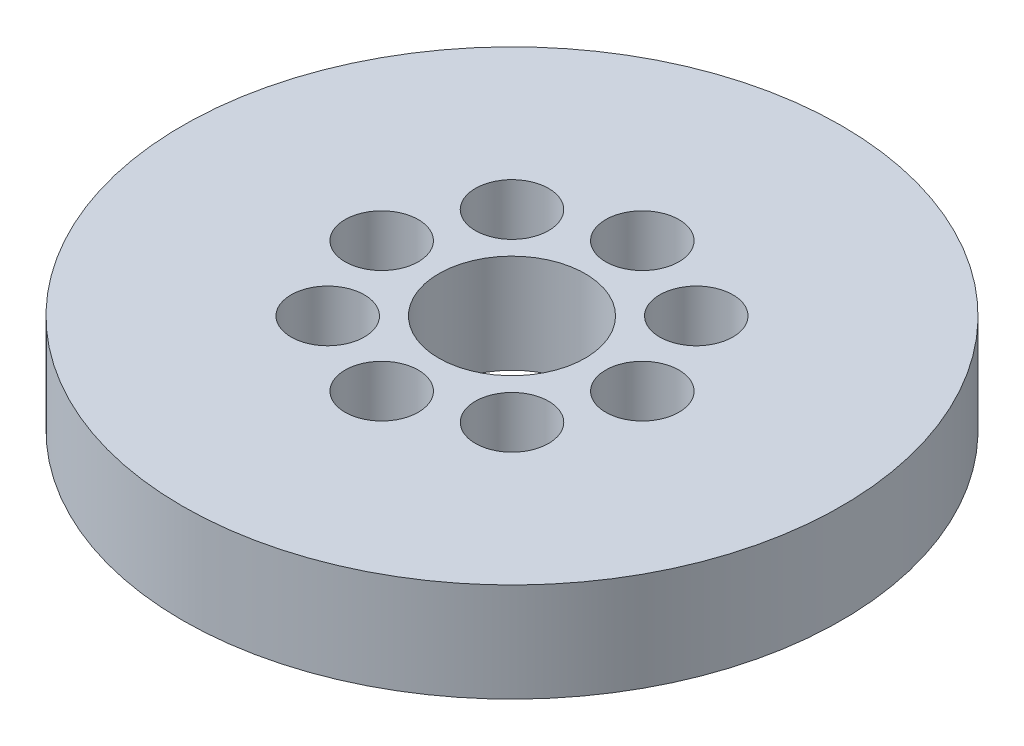
from build123d import *

# Parameters (mm, degrees)
SKETCH1_R           = 90
BOSS_EXTRUDE1_DEPTH = 27
SKETCH2_R           = 20
CUT_EXTRUDE1_DEPTH  = 131.111490653
SKETCH3_R           = 10
CUT_EXTRUDE2_DEPTH  = 20.262050617
CIRPATTERN1_COUNT   = 8


with BuildPart() as part:
    # Sketch1 → Boss-Extrude1 (new body)
    with BuildSketch(Plane(origin=(0, 0, 0), x_dir=(1, 0, 0), z_dir=(0, 1, 0))):
        Circle(SKETCH1_R)
    extrude(amount=BOSS_EXTRUDE1_DEPTH)

    # Sketch2 → Cut-Extrude1 (cut, through all)
    with BuildSketch(Plane(origin=(0, 0, 0), x_dir=(1, 0, 0), z_dir=(0, 1, 0))):
        Circle(SKETCH2_R)
    extrude(amount=CUT_EXTRUDE1_DEPTH, mode=Mode.SUBTRACT)

    # Sketch3 → Cut-Extrude2 (cut)
    with BuildSketch(Plane(origin=(0, 27, 0), x_dir=(1, 0, 0), z_dir=(0, 1, 0))):
        with Locations((-35.587690931, 0)):
            Circle(SKETCH3_R)
    cut_extrude2 = extrude(amount=-CUT_EXTRUDE2_DEPTH, mode=Mode.SUBTRACT)

    # CirPattern1: Cut-Extrude2 ×8 about axis
    cirpattern1_axis = Axis((0, 0, 0), (0, 1, 0))
    for i in range(1, CIRPATTERN1_COUNT):
        add(cut_extrude2.rotate(cirpattern1_axis, i * 360 / CIRPATTERN1_COUNT), mode=Mode.SUBTRACT)


solid = part.part
